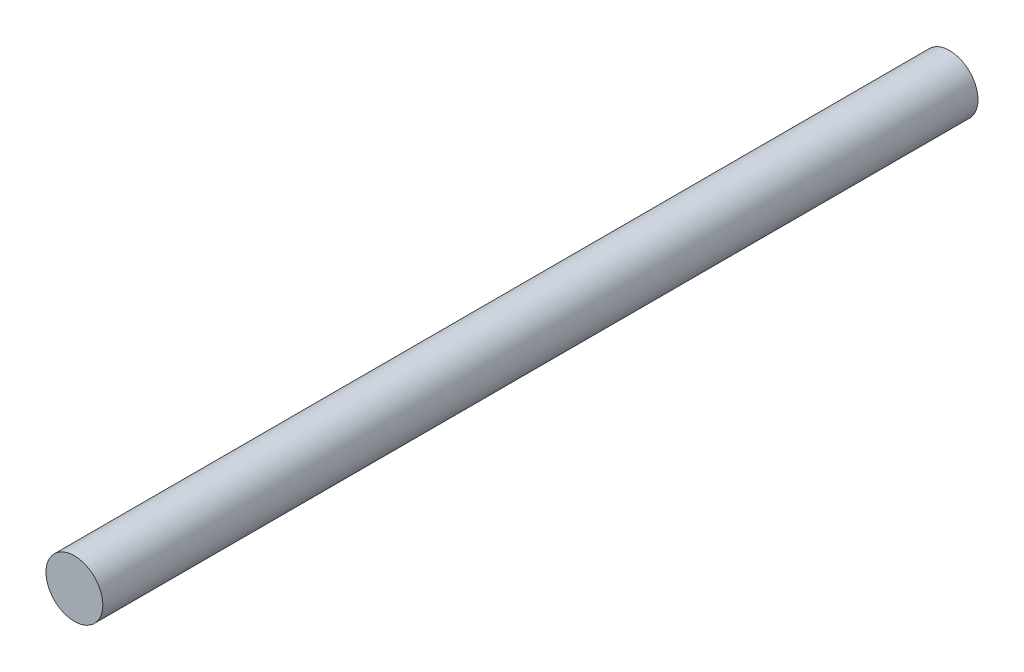
from build123d import *

# Parameters (mm, degrees)
SKETCH1_R           = 1.95
BOSS_EXTRUDE1_DEPTH = 60


with BuildPart() as part:
    # Sketch1 → Boss-Extrude1 (new body)
    with BuildSketch(Plane.XY):
        Circle(SKETCH1_R)
    extrude(amount=BOSS_EXTRUDE1_DEPTH)


solid = part.part
